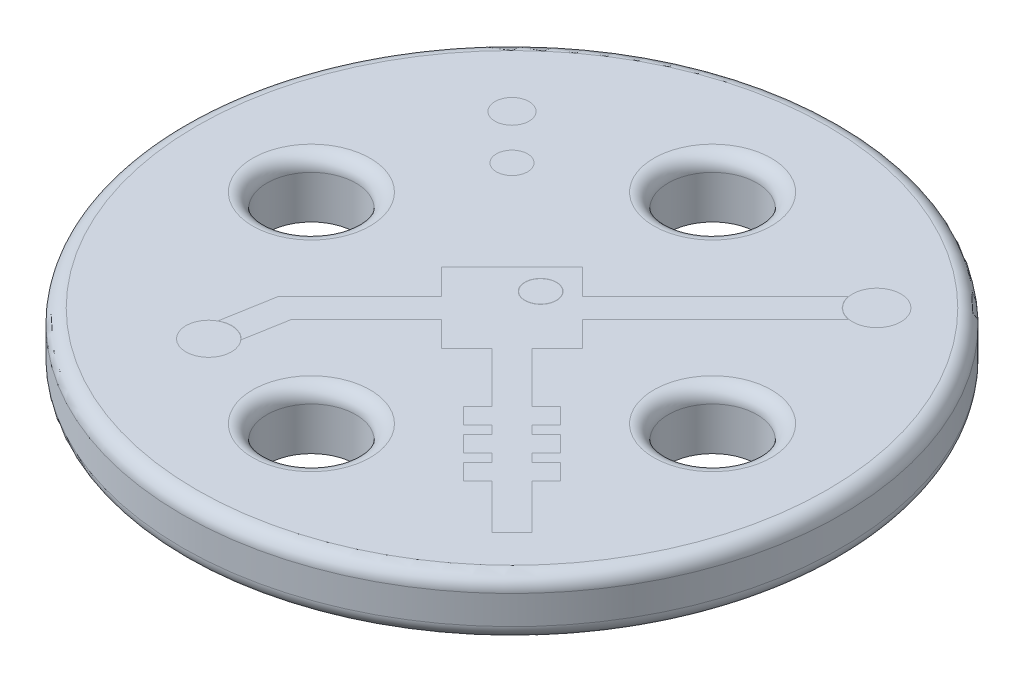
from build123d import *

# Parameters (mm, degrees)
SKETCH1_R                     = 11.5
SKETCH1_R_2                   = 1.55
BOSS_EXTRUDE1_DEPTH           = 2
FILLET1_R                     = 0.5
GL_F_SIDE_BLUE_CUT_START      = -0.5
GL_F_SIDE_BLUE_CUT_DEPTH      = 1.1
GL_F_SIDE_BLUE_INLAY_DEPTH    = 0.6
GL_F_SIDE_WHITE_CUT_START     = -0.5
GL_F_SIDE_WHITE_CUT_DEPTH     = 1.1
GL_F_SIDE_WHITE_INLAY_DEPTH   = 0.6
GL_F_SIDE_WHITE_INLAY_2_DEPTH = 0.6
GL_F_SIDE_WHITE_INLAY_3_DEPTH = 0.6
GL_F_SIDE_WHITE_INLAY_4_DEPTH = 0.6
GL_F_SIDE_WHITE_INLAY_5_DEPTH = 0.6
GL_E_SIDE_BLUE_CUT_START      = 1.4
GL_E_SIDE_BLUE_CUT_DEPTH      = 1.1
GL_E_SIDE_BLUE_INLAY_START    = 1.4
GL_E_SIDE_BLUE_INLAY_DEPTH    = 0.6
GL_E_SIDE_WHITE_CUT_START     = 1.4
GL_E_SIDE_WHITE_CUT_DEPTH     = 1.1
GL_E_SIDE_WHITE_INLAY_START   = 1.4
GL_E_SIDE_WHITE_INLAY_DEPTH   = 0.6
GL_E_SIDE_WHITE_INLAY_2_DEPTH = 0.6
GL_E_SIDE_WHITE_INLAY_3_DEPTH = 0.6
GL_E_SIDE_WHITE_INLAY_4_DEPTH = 0.6
GL_E_SIDE_WHITE_INLAY_5_DEPTH = 0.6


with BuildPart() as part:
    # Sketch1 → Boss-Extrude1 (new body)
    with BuildSketch(Plane(origin=(0, 0, 0), x_dir=(1, 0, 0), z_dir=(0, 1, 0))):
        Circle(SKETCH1_R)
        with Locations((0, 7)):
            Circle(SKETCH1_R_2, mode=Mode.SUBTRACT)
        with Locations((7, 0)):
            Circle(SKETCH1_R_2, mode=Mode.SUBTRACT)
        with Locations((0, -7)):
            Circle(SKETCH1_R_2, mode=Mode.SUBTRACT)
        with Locations((-7, 0)):
            Circle(SKETCH1_R_2, mode=Mode.SUBTRACT)
    extrude(amount=BOSS_EXTRUDE1_DEPTH)

    # Fillet1
    fillet1_edges = [part.edges().sort_by_distance(p)[0] for p in [
        (-8.55, 2, 0),
        (5.45, 2, 0),
        (-11.5, 2, 0),
        (-1.55, 2, -7),
        (-1.55, 2, 7),
        (-11.5, 0, 0),
    ]]
    fillet(fillet1_edges, radius=FILLET1_R)

    # GL_F_side_blue → GL_F_side_blue_cut (cut)
    with BuildSketch(Plane(origin=(0, 0, 0), x_dir=(1, 0, 0), z_dir=(0, 1, 0)).offset(GL_F_SIDE_BLUE_CUT_START)):
        Polygon((4.101219331, -5.791204538), (3.542604974, -5.232590181), (4.037579721, -4.737615434), (3.74766594, -4.447701654), (3.252691193, -4.9426764), (2.694076836, -4.384062043), (3.189051583, -3.889087297), (1.209152596, -1.909188309), (1.323340905, -1.795), (-1.795, -1.795), (-1.795, 1.323340905), (-1.909188309, 1.209152596), (-4.851953883, 4.151918169), (-4.716054022, 4.179390353), (-4.570146913, 4.239827057), (-4.380487824, 4.380487824), (-4.239827057, 4.570146913), (-4.179390353, 4.716054022), (-4.151918169, 4.851953883), (-1.209152596, 1.909188309), (-1.323340905, 1.795), (1.323340905, 1.795), (1.209152596, 1.909188309), (5.663722497, 6.363758211), (5.687194875, 6.257134584), (5.751365912, 6.102211995), (5.900767403, 5.900767403), (6.102211995, 5.751365912), (6.257134584, 5.687194875), (6.363758211, 5.663722497), (1.909188309, 1.209152596), (1.795, 1.323340905), (1.795, -1.323340905), (1.909188309, -1.209152596), (3.889087297, -3.189051583), (4.384062043, -2.694076836), (4.9426764, -3.252691193), (4.447701654, -3.74766594), (4.737615434, -4.037579721), (5.232590181, -3.542604974), (5.791204538, -4.101219331), (5.296229791, -4.596194078), (6.993286066, -6.293250353), (6.293250353, -6.993286066), (4.596194078, -5.296229791), align=None)
        Polygon((-0.296176538, 0.794126253), (-0.296176538, 0.902930022), (-0.3174031, 1.009643156), (-0.3590405, 1.110164731), (-0.419488634, 1.200631758), (-0.496424517, 1.27756764), (-0.586891544, 1.338015775), (-0.687413119, 1.379653175), (-0.794126253, 1.400879737), (-0.902930022, 1.400879737), (-1.009643156, 1.379653175), (-1.110164731, 1.338015775), (-1.200631758, 1.27756764), (-1.27756764, 1.200631758), (-1.338015775, 1.110164731), (-1.379653175, 1.009643156), (-1.400879737, 0.902930022), (-1.400879737, 0.794126253), (-1.379653175, 0.687413119), (-1.338015775, 0.586891544), (-1.27756764, 0.496424517), (-1.200631758, 0.419488634), (-1.110164731, 0.3590405), (-1.009643156, 0.3174031), (-0.902930022, 0.296176538), (-0.794126253, 0.296176538), (-0.687413119, 0.3174031), (-0.586891544, 0.3590405), (-0.496424517, 0.419488634), (-0.419488634, 0.496424517), (-0.3590405, 0.586891544), (-0.3174031, 0.687413119), align=None, mode=Mode.SUBTRACT)
    extrude(amount=GL_F_SIDE_BLUE_CUT_DEPTH, mode=Mode.SUBTRACT)

    # GL_F_side_white → GL_F_side_white_cut (cut)
    with BuildSketch(Plane(origin=(0, 0, 0), x_dir=(1, 0, 0), z_dir=(0, 1, 0)).offset(GL_F_SIDE_WHITE_CUT_START)):
        Polygon((-5.627987495, -6.383890654), (-5.695762229, -6.466474407), (-5.778345982, -6.534249141), (-5.872565106, -6.584610312), (-5.974798812, -6.615622568), (-6.081118318, -6.626094125), (-6.187437824, -6.615622568), (-6.289671531, -6.584610312), (-6.383890654, -6.534249141), (-6.466474407, -6.466474407), (-6.534249141, -6.383890654), (-6.584610312, -6.289671531), (-6.615622568, -6.187437824), (-6.626094125, -6.081118318), (-6.615622568, -5.974798812), (-6.584610312, -5.872565106), (-6.534249141, -5.778345982), (-6.466474407, -5.695762229), (-6.383890654, -5.627987495), (-6.289671531, -5.577626324), (-6.187437824, -5.546614068), (-6.081118318, -5.536142511), (-5.974798812, -5.546614068), (-5.872565106, -5.577626324), (-5.778345982, -5.627987495), (-5.695762229, -5.695762229), (-5.627987495, -5.778345982), (-5.577626324, -5.872565106), (-5.546614068, -5.974798812), (-5.536142511, -6.081118318), (-5.546614068, -6.187437824), (-5.577626324, -6.289671531), align=None)
        Polygon((-3.789509864, -4.545413023), (-3.857284598, -4.627996776), (-3.939868351, -4.69577151), (-4.034087475, -4.746132681), (-4.136321181, -4.777144937), (-4.242640687, -4.787616494), (-4.348960193, -4.777144937), (-4.4511939, -4.746132681), (-4.545413023, -4.69577151), (-4.627996776, -4.627996776), (-4.69577151, -4.545413023), (-4.746132681, -4.4511939), (-4.777144937, -4.348960193), (-4.787616494, -4.242640687), (-4.777144937, -4.136321181), (-4.746132681, -4.034087475), (-4.69577151, -3.939868351), (-4.627996776, -3.857284598), (-4.545413023, -3.789509864), (-4.4511939, -3.739148693), (-4.348960193, -3.708136437), (-4.242640687, -3.69766488), (-4.136321181, -3.708136437), (-4.034087475, -3.739148693), (-3.939868351, -3.789509864), (-3.857284598, -3.857284598), (-3.789509864, -3.939868351), (-3.739148693, -4.034087475), (-3.708136437, -4.136321181), (-3.69766488, -4.242640687), (-3.708136437, -4.348960193), (-3.739148693, -4.4511939), align=None)
        Polygon((-0.395397314, 0.545755801), (-0.463172049, 0.463172049), (-0.545755801, 0.395397314), (-0.639974925, 0.345036143), (-0.742208632, 0.314023888), (-0.848528137, 0.30355233), (-0.954847643, 0.314023888), (-1.05708135, 0.345036143), (-1.151300474, 0.395397314), (-1.233884226, 0.463172049), (-1.30165896, 0.545755801), (-1.352020131, 0.639974925), (-1.383032387, 0.742208632), (-1.393503945, 0.848528137), (-1.383032387, 0.954847643), (-1.352020131, 1.05708135), (-1.30165896, 1.151300474), (-1.233884226, 1.233884226), (-1.151300474, 1.30165896), (-1.05708135, 1.352020131), (-0.954847643, 1.383032387), (-0.848528137, 1.393503945), (-0.742208632, 1.383032387), (-0.639974925, 1.352020131), (-0.545755801, 1.30165896), (-0.463172049, 1.233884226), (-0.395397314, 1.151300474), (-0.345036143, 1.05708135), (-0.314023888, 0.954847643), (-0.30355233, 0.848528137), (-0.314023888, 0.742208632), (-0.345036143, 0.639974925), align=None)
        Polygon((-4.387614684, 4.387614684), (-4.508082574, 4.288749242), (-4.645523398, 4.215285591), (-4.794655382, 4.170046898), (-4.949747468, 4.154771661), (-5.104839555, 4.170046898), (-5.253971539, 4.215285591), (-5.391412363, 4.288749242), (-5.511880252, 4.387614684), (-5.610745694, 4.508082574), (-5.684209345, 4.645523398), (-5.729448038, 4.794655382), (-5.744723275, 4.949747468), (-5.729448038, 5.104839555), (-5.684209345, 5.253971539), (-5.610745694, 5.391412363), (-5.511880252, 5.511880252), (-5.391412363, 5.610745694), (-5.253971539, 5.684209345), (-5.104839555, 5.729448038), (-4.949747468, 5.744723275), (-4.794655382, 5.729448038), (-4.645523398, 5.684209345), (-4.508082574, 5.610745694), (-4.387614684, 5.511880252), (-4.288749242, 5.391412363), (-4.215285591, 5.253971539), (-4.170046898, 5.104839555), (-4.154771661, 4.949747468), (-4.170046898, 4.794655382), (-4.215285591, 4.645523398), (-4.288749242, 4.508082574), align=None)
        Polygon((7.10287051, 5.907894264), (6.974825793, 5.80281068), (6.828740629, 5.724726533), (6.670228989, 5.676642553), (6.505382387, 5.66040658), (6.340535785, 5.676642553), (6.182024145, 5.724726533), (6.035938981, 5.80281068), (5.907894264, 5.907894264), (5.80281068, 6.035938981), (5.724726533, 6.182024145), (5.676642553, 6.340535785), (5.66040658, 6.505382387), (5.676642553, 6.670228989), (5.724726533, 6.828740629), (5.80281068, 6.974825793), (5.907894264, 7.10287051), (6.035938981, 7.207954094), (6.182024145, 7.286038241), (6.340535785, 7.334122221), (6.505382387, 7.350358194), (6.670228989, 7.334122221), (6.828740629, 7.286038241), (6.974825793, 7.207954094), (7.10287051, 7.10287051), (7.207954094, 6.974825793), (7.286038241, 6.828740629), (7.334122221, 6.670228989), (7.350358194, 6.505382387), (7.334122221, 6.340535785), (7.286038241, 6.182024145), (7.207954094, 6.035938981), align=None)
    extrude(amount=GL_F_SIDE_WHITE_CUT_DEPTH, mode=Mode.SUBTRACT)

    # GL_E_side_blue → GL_E_side_blue_cut (cut)
    with BuildSketch(Plane(origin=(0, 0, 0), x_dir=(1, 0, 0), z_dir=(0, 1, 0)).offset(GL_E_SIDE_BLUE_CUT_START)):
        Polygon((4.384062043, -6.07404725), (3.825447686, -5.515432893), (4.320422433, -5.020458146), (4.030508653, -4.730544366), (3.535533906, -5.225519113), (2.976919549, -4.666904756), (3.471894296, -4.171930009), (3.181980515, -3.882016229), (2.687005769, -4.376990976), (2.128391411, -3.818376618), (2.623366158, -3.323401872), (0.883883476, -1.58391919), (0, -2.467802666), (-0.883883476, -1.58391919), (-3.499409102, -4.199444815), (-3.761831835, -5.688207176), (-3.84849988, -5.603249452), (-3.979798436, -5.515518562), (-4.202004851, -5.436011835), (-4.359180916, -5.420531344), (-4.516373466, -5.436013459), (-4.736831203, -5.516520655), (-4.420186847, -3.720151134), (-1.58391919, -0.883883476), (-2.467802666, 0), (0, 2.467802666), (0.883883476, 1.58391919), (5.522301141, 6.222336854), (5.545773518, 6.115713228), (5.609944556, 5.960790639), (5.759346047, 5.759346047), (5.960790639, 5.609944556), (6.115713228, 5.545773518), (6.222336854, 5.522301141), (1.58391919, 0.883883476), (2.467802666, 0), (1.58391919, -0.883883476), (3.323401872, -2.623366158), (3.818376618, -2.128391411), (4.376990976, -2.687005769), (3.882016229, -3.181980515), (4.171930009, -3.471894296), (4.666904756, -2.976919549), (5.225519113, -3.535533906), (4.730544366, -4.030508653), (5.020458146, -4.320422433), (5.515432893, -3.825447686), (6.07404725, -4.384062043), (5.579072504, -4.87903679), (7.134707422, -6.434671709), (6.434671709, -7.134707422), (4.87903679, -5.579072504), align=None)
        Polygon((0.5523516, 0.945598116), (0.5523516, 1.054401884), (0.531125037, 1.161115019), (0.489487638, 1.261636593), (0.429039503, 1.35210362), (0.35210362, 1.429039503), (0.261636593, 1.489487638), (0.161115019, 1.531125037), (0.054401884, 1.5523516), (-0.054401884, 1.5523516), (-0.161115019, 1.531125037), (-0.261636593, 1.489487638), (-0.35210362, 1.429039503), (-0.429039503, 1.35210362), (-0.489487638, 1.261636593), (-0.531125037, 1.161115019), (-0.5523516, 1.054401884), (-0.5523516, 0.945598116), (-0.531125037, 0.838884981), (-0.489487638, 0.738363407), (-0.429039503, 0.64789638), (-0.35210362, 0.570960497), (-0.261636593, 0.510512362), (-0.161115019, 0.468874963), (-0.054401884, 0.4476484), (0.054401884, 0.4476484), (0.161115019, 0.468874963), (0.261636593, 0.510512362), (0.35210362, 0.570960497), (0.429039503, 0.64789638), (0.489487638, 0.738363407), (0.531125037, 0.838884981), align=None, mode=Mode.SUBTRACT)
    extrude(amount=GL_E_SIDE_BLUE_CUT_DEPTH, mode=Mode.SUBTRACT)

    # GL_E_side_white → GL_E_side_white_cut (cut)
    with BuildSketch(Plane(origin=(0, 0, 0), x_dir=(1, 0, 0), z_dir=(0, 1, 0)).offset(GL_E_SIDE_WHITE_CUT_START)):
        Polygon((-3.69818269, -6.667220431), (-3.797048132, -6.787688321), (-3.917516022, -6.886553763), (-4.054956846, -6.960017414), (-4.20408883, -7.005256107), (-4.359180916, -7.020531344), (-4.514273002, -7.005256107), (-4.663404987, -6.960017414), (-4.800845811, -6.886553763), (-4.9213137, -6.787688321), (-5.020179142, -6.667220431), (-5.093642793, -6.529779607), (-5.138881486, -6.380647623), (-5.154156723, -6.225555537), (-5.138881486, -6.07046345), (-5.093642793, -5.921331466), (-5.020179142, -5.783890642), (-4.9213137, -5.663422752), (-4.800845811, -5.56455731), (-4.663404987, -5.49109366), (-4.514273002, -5.445854967), (-4.359180916, -5.430579729), (-4.20408883, -5.445854967), (-4.054956846, -5.49109366), (-3.917516022, -5.56455731), (-3.797048132, -5.663422752), (-3.69818269, -5.783890642), (-3.624719039, -5.921331466), (-3.579480346, -6.07046345), (-3.564205109, -6.225555537), (-3.579480346, -6.380647623), (-3.624719039, -6.529779607), align=None)
        Polygon((0.453130823, 0.697227664), (0.385356089, 0.614643911), (0.302772336, 0.546869177), (0.208553212, 0.496508006), (0.106319506, 0.46549575), (0, 0.455024193), (-0.106319506, 0.46549575), (-0.208553212, 0.496508006), (-0.302772336, 0.546869177), (-0.385356089, 0.614643911), (-0.453130823, 0.697227664), (-0.503491994, 0.791446788), (-0.53450425, 0.893680494), (-0.544975807, 1), (-0.53450425, 1.106319506), (-0.503491994, 1.208553212), (-0.453130823, 1.302772336), (-0.385356089, 1.385356089), (-0.302772336, 1.453130823), (-0.208553212, 1.503491994), (-0.106319506, 1.53450425), (0, 1.544975807), (0.106319506, 1.53450425), (0.208553212, 1.503491994), (0.302772336, 1.453130823), (0.385356089, 1.385356089), (0.453130823, 1.302772336), (0.503491994, 1.208553212), (0.53450425, 1.106319506), (0.544975807, 1), (0.53450425, 0.893680494), (0.503491994, 0.791446788), align=None)
        Polygon((-3.93093122, 4.081289707), (-3.998705955, 3.998705955), (-4.081289707, 3.93093122), (-4.175508831, 3.880570049), (-4.277742538, 3.849557794), (-4.384062043, 3.839086236), (-4.490381549, 3.849557794), (-4.592615256, 3.880570049), (-4.68683438, 3.93093122), (-4.769418132, 3.998705955), (-4.837192866, 4.081289707), (-4.887554037, 4.175508831), (-4.918566293, 4.277742538), (-4.92903785, 4.384062043), (-4.918566293, 4.490381549), (-4.887554037, 4.592615256), (-4.837192866, 4.68683438), (-4.769418132, 4.769418132), (-4.68683438, 4.837192866), (-4.592615256, 4.887554037), (-4.490381549, 4.918566293), (-4.384062043, 4.92903785), (-4.277742538, 4.918566293), (-4.175508831, 4.887554037), (-4.081289707, 4.837192866), (-3.998705955, 4.769418132), (-3.93093122, 4.68683438), (-3.880570049, 4.592615256), (-3.849557794, 4.490381549), (-3.839086236, 4.384062043), (-3.849557794, 4.277742538), (-3.880570049, 4.175508831), align=None)
        Polygon((-5.518985534, 5.518985534), (-5.609146114, 5.444992658), (-5.712009578, 5.390010991), (-5.82362294, 5.356153448), (-5.939696962, 5.344721155), (-6.055770984, 5.356153448), (-6.167384346, 5.390010991), (-6.27024781, 5.444992658), (-6.36040839, 5.518985534), (-6.434401266, 5.609146114), (-6.489382933, 5.712009578), (-6.523240476, 5.82362294), (-6.534672769, 5.939696962), (-6.523240476, 6.055770984), (-6.489382933, 6.167384346), (-6.434401266, 6.27024781), (-6.36040839, 6.36040839), (-6.27024781, 6.434401266), (-6.167384346, 6.489382933), (-6.055770984, 6.523240476), (-5.939696962, 6.534672769), (-5.82362294, 6.523240476), (-5.712009578, 6.489382933), (-5.609146114, 6.434401266), (-5.518985534, 6.36040839), (-5.444992658, 6.27024781), (-5.390010991, 6.167384346), (-5.356153448, 6.055770984), (-5.344721155, 5.939696962), (-5.356153448, 5.82362294), (-5.390010991, 5.712009578), (-5.444992658, 5.609146114), align=None)
        Polygon((6.961449154, 5.766472908), (6.833404437, 5.661389324), (6.687319273, 5.583305177), (6.528807633, 5.535221197), (6.363961031, 5.518985224), (6.199114428, 5.535221197), (6.040602789, 5.583305177), (5.894517625, 5.661389324), (5.766472908, 5.766472908), (5.661389324, 5.894517625), (5.583305177, 6.040602789), (5.535221197, 6.199114428), (5.518985224, 6.363961031), (5.535221197, 6.528807633), (5.583305177, 6.687319273), (5.661389324, 6.833404437), (5.766472908, 6.961449154), (5.894517625, 7.066532737), (6.040602789, 7.144616884), (6.199114428, 7.192700865), (6.363961031, 7.208936838), (6.528807633, 7.192700865), (6.687319273, 7.144616884), (6.833404437, 7.066532737), (6.961449154, 6.961449154), (7.066532737, 6.833404437), (7.144616884, 6.687319273), (7.192700865, 6.528807633), (7.208936838, 6.363961031), (7.192700865, 6.199114428), (7.144616884, 6.040602789), (7.066532737, 5.894517625), align=None)
    extrude(amount=GL_E_SIDE_WHITE_CUT_DEPTH, mode=Mode.SUBTRACT)


with BuildPart() as body_2:
    # GL_F_side_blue<2> → GL_F_side_blue_inlay (new body)
    with BuildSketch(Plane(origin=(0, 0, 0), x_dir=(1, 0, 0), z_dir=(0, 1, 0))):
        Polygon((4.101219331, -5.791204538), (3.542604974, -5.232590181), (4.037579721, -4.737615434), (3.74766594, -4.447701654), (3.252691193, -4.9426764), (2.694076836, -4.384062043), (3.189051583, -3.889087297), (1.209152596, -1.909188309), (1.323340905, -1.795), (-1.795, -1.795), (-1.795, 1.323340905), (-1.909188309, 1.209152596), (-4.851953883, 4.151918169), (-4.716054022, 4.179390353), (-4.570146913, 4.239827057), (-4.380487824, 4.380487824), (-4.239827057, 4.570146913), (-4.179390353, 4.716054022), (-4.151918169, 4.851953883), (-1.209152596, 1.909188309), (-1.323340905, 1.795), (1.323340905, 1.795), (1.209152596, 1.909188309), (5.663722497, 6.363758211), (5.687194875, 6.257134584), (5.751365912, 6.102211995), (5.900767403, 5.900767403), (6.102211995, 5.751365912), (6.257134584, 5.687194875), (6.363758211, 5.663722497), (1.909188309, 1.209152596), (1.795, 1.323340905), (1.795, -1.323340905), (1.909188309, -1.209152596), (3.889087297, -3.189051583), (4.384062043, -2.694076836), (4.9426764, -3.252691193), (4.447701654, -3.74766594), (4.737615434, -4.037579721), (5.232590181, -3.542604974), (5.791204538, -4.101219331), (5.296229791, -4.596194078), (6.993286066, -6.293250353), (6.293250353, -6.993286066), (4.596194078, -5.296229791), align=None)
        Polygon((-0.296176538, 0.794126253), (-0.296176538, 0.902930022), (-0.3174031, 1.009643156), (-0.3590405, 1.110164731), (-0.419488634, 1.200631758), (-0.496424517, 1.27756764), (-0.586891544, 1.338015775), (-0.687413119, 1.379653175), (-0.794126253, 1.400879737), (-0.902930022, 1.400879737), (-1.009643156, 1.379653175), (-1.110164731, 1.338015775), (-1.200631758, 1.27756764), (-1.27756764, 1.200631758), (-1.338015775, 1.110164731), (-1.379653175, 1.009643156), (-1.400879737, 0.902930022), (-1.400879737, 0.794126253), (-1.379653175, 0.687413119), (-1.338015775, 0.586891544), (-1.27756764, 0.496424517), (-1.200631758, 0.419488634), (-1.110164731, 0.3590405), (-1.009643156, 0.3174031), (-0.902930022, 0.296176538), (-0.794126253, 0.296176538), (-0.687413119, 0.3174031), (-0.586891544, 0.3590405), (-0.496424517, 0.419488634), (-0.419488634, 0.496424517), (-0.3590405, 0.586891544), (-0.3174031, 0.687413119), align=None, mode=Mode.SUBTRACT)
    extrude(amount=GL_F_SIDE_BLUE_INLAY_DEPTH)


with BuildPart() as body_3:
    # GL_F_side_white<2> → GL_F_side_white_inlay (new body)
    with BuildSketch(Plane(origin=(0, 0, 0), x_dir=(1, 0, 0), z_dir=(0, 1, 0))):
        Polygon((-5.627987495, -6.383890654), (-5.695762229, -6.466474407), (-5.778345982, -6.534249141), (-5.872565106, -6.584610312), (-5.974798812, -6.615622568), (-6.081118318, -6.626094125), (-6.187437824, -6.615622568), (-6.289671531, -6.584610312), (-6.383890654, -6.534249141), (-6.466474407, -6.466474407), (-6.534249141, -6.383890654), (-6.584610312, -6.289671531), (-6.615622568, -6.187437824), (-6.626094125, -6.081118318), (-6.615622568, -5.974798812), (-6.584610312, -5.872565106), (-6.534249141, -5.778345982), (-6.466474407, -5.695762229), (-6.383890654, -5.627987495), (-6.289671531, -5.577626324), (-6.187437824, -5.546614068), (-6.081118318, -5.536142511), (-5.974798812, -5.546614068), (-5.872565106, -5.577626324), (-5.778345982, -5.627987495), (-5.695762229, -5.695762229), (-5.627987495, -5.778345982), (-5.577626324, -5.872565106), (-5.546614068, -5.974798812), (-5.536142511, -6.081118318), (-5.546614068, -6.187437824), (-5.577626324, -6.289671531), align=None)
    extrude(amount=GL_F_SIDE_WHITE_INLAY_DEPTH)


with BuildPart() as body_4:
    # GL_F_side_white<2> → GL_F_side_white_inlay 2 (new body)
    with BuildSketch(Plane(origin=(0, 0, 0), x_dir=(1, 0, 0), z_dir=(0, 1, 0))):
        Polygon((-3.789509864, -4.545413023), (-3.857284598, -4.627996776), (-3.939868351, -4.69577151), (-4.034087475, -4.746132681), (-4.136321181, -4.777144937), (-4.242640687, -4.787616494), (-4.348960193, -4.777144937), (-4.4511939, -4.746132681), (-4.545413023, -4.69577151), (-4.627996776, -4.627996776), (-4.69577151, -4.545413023), (-4.746132681, -4.4511939), (-4.777144937, -4.348960193), (-4.787616494, -4.242640687), (-4.777144937, -4.136321181), (-4.746132681, -4.034087475), (-4.69577151, -3.939868351), (-4.627996776, -3.857284598), (-4.545413023, -3.789509864), (-4.4511939, -3.739148693), (-4.348960193, -3.708136437), (-4.242640687, -3.69766488), (-4.136321181, -3.708136437), (-4.034087475, -3.739148693), (-3.939868351, -3.789509864), (-3.857284598, -3.857284598), (-3.789509864, -3.939868351), (-3.739148693, -4.034087475), (-3.708136437, -4.136321181), (-3.69766488, -4.242640687), (-3.708136437, -4.348960193), (-3.739148693, -4.4511939), align=None)
    extrude(amount=GL_F_SIDE_WHITE_INLAY_2_DEPTH)


with BuildPart() as body_5:
    # GL_F_side_white<2> → GL_F_side_white_inlay 3 (new body)
    with BuildSketch(Plane(origin=(0, 0, 0), x_dir=(1, 0, 0), z_dir=(0, 1, 0))):
        Polygon((-0.395397314, 0.545755801), (-0.463172049, 0.463172049), (-0.545755801, 0.395397314), (-0.639974925, 0.345036143), (-0.742208632, 0.314023888), (-0.848528137, 0.30355233), (-0.954847643, 0.314023888), (-1.05708135, 0.345036143), (-1.151300474, 0.395397314), (-1.233884226, 0.463172049), (-1.30165896, 0.545755801), (-1.352020131, 0.639974925), (-1.383032387, 0.742208632), (-1.393503945, 0.848528137), (-1.383032387, 0.954847643), (-1.352020131, 1.05708135), (-1.30165896, 1.151300474), (-1.233884226, 1.233884226), (-1.151300474, 1.30165896), (-1.05708135, 1.352020131), (-0.954847643, 1.383032387), (-0.848528137, 1.393503945), (-0.742208632, 1.383032387), (-0.639974925, 1.352020131), (-0.545755801, 1.30165896), (-0.463172049, 1.233884226), (-0.395397314, 1.151300474), (-0.345036143, 1.05708135), (-0.314023888, 0.954847643), (-0.30355233, 0.848528137), (-0.314023888, 0.742208632), (-0.345036143, 0.639974925), align=None)
    extrude(amount=GL_F_SIDE_WHITE_INLAY_3_DEPTH)


with BuildPart() as body_6:
    # GL_F_side_white<2> → GL_F_side_white_inlay 4 (new body)
    with BuildSketch(Plane(origin=(0, 0, 0), x_dir=(1, 0, 0), z_dir=(0, 1, 0))):
        Polygon((-4.387614684, 4.387614684), (-4.508082574, 4.288749242), (-4.645523398, 4.215285591), (-4.794655382, 4.170046898), (-4.949747468, 4.154771661), (-5.104839555, 4.170046898), (-5.253971539, 4.215285591), (-5.391412363, 4.288749242), (-5.511880252, 4.387614684), (-5.610745694, 4.508082574), (-5.684209345, 4.645523398), (-5.729448038, 4.794655382), (-5.744723275, 4.949747468), (-5.729448038, 5.104839555), (-5.684209345, 5.253971539), (-5.610745694, 5.391412363), (-5.511880252, 5.511880252), (-5.391412363, 5.610745694), (-5.253971539, 5.684209345), (-5.104839555, 5.729448038), (-4.949747468, 5.744723275), (-4.794655382, 5.729448038), (-4.645523398, 5.684209345), (-4.508082574, 5.610745694), (-4.387614684, 5.511880252), (-4.288749242, 5.391412363), (-4.215285591, 5.253971539), (-4.170046898, 5.104839555), (-4.154771661, 4.949747468), (-4.170046898, 4.794655382), (-4.215285591, 4.645523398), (-4.288749242, 4.508082574), align=None)
    extrude(amount=GL_F_SIDE_WHITE_INLAY_4_DEPTH)


with BuildPart() as body_7:
    # GL_F_side_white<2> → GL_F_side_white_inlay 5 (new body)
    with BuildSketch(Plane(origin=(0, 0, 0), x_dir=(1, 0, 0), z_dir=(0, 1, 0))):
        Polygon((7.10287051, 5.907894264), (6.974825793, 5.80281068), (6.828740629, 5.724726533), (6.670228989, 5.676642553), (6.505382387, 5.66040658), (6.340535785, 5.676642553), (6.182024145, 5.724726533), (6.035938981, 5.80281068), (5.907894264, 5.907894264), (5.80281068, 6.035938981), (5.724726533, 6.182024145), (5.676642553, 6.340535785), (5.66040658, 6.505382387), (5.676642553, 6.670228989), (5.724726533, 6.828740629), (5.80281068, 6.974825793), (5.907894264, 7.10287051), (6.035938981, 7.207954094), (6.182024145, 7.286038241), (6.340535785, 7.334122221), (6.505382387, 7.350358194), (6.670228989, 7.334122221), (6.828740629, 7.286038241), (6.974825793, 7.207954094), (7.10287051, 7.10287051), (7.207954094, 6.974825793), (7.286038241, 6.828740629), (7.334122221, 6.670228989), (7.350358194, 6.505382387), (7.334122221, 6.340535785), (7.286038241, 6.182024145), (7.207954094, 6.035938981), align=None)
    extrude(amount=GL_F_SIDE_WHITE_INLAY_5_DEPTH)


with BuildPart() as body_8:
    # GL_E_side_blue<2> → GL_E_side_blue_inlay (new body)
    with BuildSketch(Plane(origin=(0, 0, 0), x_dir=(1, 0, 0), z_dir=(0, 1, 0)).offset(GL_E_SIDE_BLUE_INLAY_START)):
        Polygon((4.384062043, -6.07404725), (3.825447686, -5.515432893), (4.320422433, -5.020458146), (4.030508653, -4.730544366), (3.535533906, -5.225519113), (2.976919549, -4.666904756), (3.471894296, -4.171930009), (3.181980515, -3.882016229), (2.687005769, -4.376990976), (2.128391411, -3.818376618), (2.623366158, -3.323401872), (0.883883476, -1.58391919), (0, -2.467802666), (-0.883883476, -1.58391919), (-3.499409102, -4.199444815), (-3.761831835, -5.688207176), (-3.84849988, -5.603249452), (-3.979798436, -5.515518562), (-4.202004851, -5.436011835), (-4.359180916, -5.420531344), (-4.516373466, -5.436013459), (-4.736831203, -5.516520655), (-4.420186847, -3.720151134), (-1.58391919, -0.883883476), (-2.467802666, 0), (0, 2.467802666), (0.883883476, 1.58391919), (5.522301141, 6.222336854), (5.545773518, 6.115713228), (5.609944556, 5.960790639), (5.759346047, 5.759346047), (5.960790639, 5.609944556), (6.115713228, 5.545773518), (6.222336854, 5.522301141), (1.58391919, 0.883883476), (2.467802666, 0), (1.58391919, -0.883883476), (3.323401872, -2.623366158), (3.818376618, -2.128391411), (4.376990976, -2.687005769), (3.882016229, -3.181980515), (4.171930009, -3.471894296), (4.666904756, -2.976919549), (5.225519113, -3.535533906), (4.730544366, -4.030508653), (5.020458146, -4.320422433), (5.515432893, -3.825447686), (6.07404725, -4.384062043), (5.579072504, -4.87903679), (7.134707422, -6.434671709), (6.434671709, -7.134707422), (4.87903679, -5.579072504), align=None)
        Polygon((0.5523516, 0.945598116), (0.5523516, 1.054401884), (0.531125037, 1.161115019), (0.489487638, 1.261636593), (0.429039503, 1.35210362), (0.35210362, 1.429039503), (0.261636593, 1.489487638), (0.161115019, 1.531125037), (0.054401884, 1.5523516), (-0.054401884, 1.5523516), (-0.161115019, 1.531125037), (-0.261636593, 1.489487638), (-0.35210362, 1.429039503), (-0.429039503, 1.35210362), (-0.489487638, 1.261636593), (-0.531125037, 1.161115019), (-0.5523516, 1.054401884), (-0.5523516, 0.945598116), (-0.531125037, 0.838884981), (-0.489487638, 0.738363407), (-0.429039503, 0.64789638), (-0.35210362, 0.570960497), (-0.261636593, 0.510512362), (-0.161115019, 0.468874963), (-0.054401884, 0.4476484), (0.054401884, 0.4476484), (0.161115019, 0.468874963), (0.261636593, 0.510512362), (0.35210362, 0.570960497), (0.429039503, 0.64789638), (0.489487638, 0.738363407), (0.531125037, 0.838884981), align=None, mode=Mode.SUBTRACT)
    extrude(amount=GL_E_SIDE_BLUE_INLAY_DEPTH)


with BuildPart() as body_9:
    # GL_E_side_white<2> → GL_E_side_white_inlay (new body)
    with BuildSketch(Plane(origin=(0, 0, 0), x_dir=(1, 0, 0), z_dir=(0, 1, 0)).offset(GL_E_SIDE_WHITE_INLAY_START)):
        Polygon((-3.69818269, -6.667220431), (-3.797048132, -6.787688321), (-3.917516022, -6.886553763), (-4.054956846, -6.960017414), (-4.20408883, -7.005256107), (-4.359180916, -7.020531344), (-4.514273002, -7.005256107), (-4.663404987, -6.960017414), (-4.800845811, -6.886553763), (-4.9213137, -6.787688321), (-5.020179142, -6.667220431), (-5.093642793, -6.529779607), (-5.138881486, -6.380647623), (-5.154156723, -6.225555537), (-5.138881486, -6.07046345), (-5.093642793, -5.921331466), (-5.020179142, -5.783890642), (-4.9213137, -5.663422752), (-4.800845811, -5.56455731), (-4.663404987, -5.49109366), (-4.514273002, -5.445854967), (-4.359180916, -5.430579729), (-4.20408883, -5.445854967), (-4.054956846, -5.49109366), (-3.917516022, -5.56455731), (-3.797048132, -5.663422752), (-3.69818269, -5.783890642), (-3.624719039, -5.921331466), (-3.579480346, -6.07046345), (-3.564205109, -6.225555537), (-3.579480346, -6.380647623), (-3.624719039, -6.529779607), align=None)
    extrude(amount=GL_E_SIDE_WHITE_INLAY_DEPTH)


with BuildPart() as body_10:
    # GL_E_side_white<2> → GL_E_side_white_inlay 2 (new body)
    with BuildSketch(Plane(origin=(0, 0, 0), x_dir=(1, 0, 0), z_dir=(0, 1, 0)).offset(GL_E_SIDE_WHITE_INLAY_START)):
        Polygon((0.453130823, 0.697227664), (0.385356089, 0.614643911), (0.302772336, 0.546869177), (0.208553212, 0.496508006), (0.106319506, 0.46549575), (0, 0.455024193), (-0.106319506, 0.46549575), (-0.208553212, 0.496508006), (-0.302772336, 0.546869177), (-0.385356089, 0.614643911), (-0.453130823, 0.697227664), (-0.503491994, 0.791446788), (-0.53450425, 0.893680494), (-0.544975807, 1), (-0.53450425, 1.106319506), (-0.503491994, 1.208553212), (-0.453130823, 1.302772336), (-0.385356089, 1.385356089), (-0.302772336, 1.453130823), (-0.208553212, 1.503491994), (-0.106319506, 1.53450425), (0, 1.544975807), (0.106319506, 1.53450425), (0.208553212, 1.503491994), (0.302772336, 1.453130823), (0.385356089, 1.385356089), (0.453130823, 1.302772336), (0.503491994, 1.208553212), (0.53450425, 1.106319506), (0.544975807, 1), (0.53450425, 0.893680494), (0.503491994, 0.791446788), align=None)
    extrude(amount=GL_E_SIDE_WHITE_INLAY_2_DEPTH)


with BuildPart() as body_11:
    # GL_E_side_white<2> → GL_E_side_white_inlay 3 (new body)
    with BuildSketch(Plane(origin=(0, 0, 0), x_dir=(1, 0, 0), z_dir=(0, 1, 0)).offset(GL_E_SIDE_WHITE_INLAY_START)):
        Polygon((-3.93093122, 4.081289707), (-3.998705955, 3.998705955), (-4.081289707, 3.93093122), (-4.175508831, 3.880570049), (-4.277742538, 3.849557794), (-4.384062043, 3.839086236), (-4.490381549, 3.849557794), (-4.592615256, 3.880570049), (-4.68683438, 3.93093122), (-4.769418132, 3.998705955), (-4.837192866, 4.081289707), (-4.887554037, 4.175508831), (-4.918566293, 4.277742538), (-4.92903785, 4.384062043), (-4.918566293, 4.490381549), (-4.887554037, 4.592615256), (-4.837192866, 4.68683438), (-4.769418132, 4.769418132), (-4.68683438, 4.837192866), (-4.592615256, 4.887554037), (-4.490381549, 4.918566293), (-4.384062043, 4.92903785), (-4.277742538, 4.918566293), (-4.175508831, 4.887554037), (-4.081289707, 4.837192866), (-3.998705955, 4.769418132), (-3.93093122, 4.68683438), (-3.880570049, 4.592615256), (-3.849557794, 4.490381549), (-3.839086236, 4.384062043), (-3.849557794, 4.277742538), (-3.880570049, 4.175508831), align=None)
    extrude(amount=GL_E_SIDE_WHITE_INLAY_3_DEPTH)


with BuildPart() as body_12:
    # GL_E_side_white<2> → GL_E_side_white_inlay 4 (new body)
    with BuildSketch(Plane(origin=(0, 0, 0), x_dir=(1, 0, 0), z_dir=(0, 1, 0)).offset(GL_E_SIDE_WHITE_INLAY_START)):
        Polygon((-5.518985534, 5.518985534), (-5.609146114, 5.444992658), (-5.712009578, 5.390010991), (-5.82362294, 5.356153448), (-5.939696962, 5.344721155), (-6.055770984, 5.356153448), (-6.167384346, 5.390010991), (-6.27024781, 5.444992658), (-6.36040839, 5.518985534), (-6.434401266, 5.609146114), (-6.489382933, 5.712009578), (-6.523240476, 5.82362294), (-6.534672769, 5.939696962), (-6.523240476, 6.055770984), (-6.489382933, 6.167384346), (-6.434401266, 6.27024781), (-6.36040839, 6.36040839), (-6.27024781, 6.434401266), (-6.167384346, 6.489382933), (-6.055770984, 6.523240476), (-5.939696962, 6.534672769), (-5.82362294, 6.523240476), (-5.712009578, 6.489382933), (-5.609146114, 6.434401266), (-5.518985534, 6.36040839), (-5.444992658, 6.27024781), (-5.390010991, 6.167384346), (-5.356153448, 6.055770984), (-5.344721155, 5.939696962), (-5.356153448, 5.82362294), (-5.390010991, 5.712009578), (-5.444992658, 5.609146114), align=None)
    extrude(amount=GL_E_SIDE_WHITE_INLAY_4_DEPTH)


with BuildPart() as body_13:
    # GL_E_side_white<2> → GL_E_side_white_inlay 5 (new body)
    with BuildSketch(Plane(origin=(0, 0, 0), x_dir=(1, 0, 0), z_dir=(0, 1, 0)).offset(GL_E_SIDE_WHITE_INLAY_START)):
        Polygon((6.961449154, 5.766472908), (6.833404437, 5.661389324), (6.687319273, 5.583305177), (6.528807633, 5.535221197), (6.363961031, 5.518985224), (6.199114428, 5.535221197), (6.040602789, 5.583305177), (5.894517625, 5.661389324), (5.766472908, 5.766472908), (5.661389324, 5.894517625), (5.583305177, 6.040602789), (5.535221197, 6.199114428), (5.518985224, 6.363961031), (5.535221197, 6.528807633), (5.583305177, 6.687319273), (5.661389324, 6.833404437), (5.766472908, 6.961449154), (5.894517625, 7.066532737), (6.040602789, 7.144616884), (6.199114428, 7.192700865), (6.363961031, 7.208936838), (6.528807633, 7.192700865), (6.687319273, 7.144616884), (6.833404437, 7.066532737), (6.961449154, 6.961449154), (7.066532737, 6.833404437), (7.144616884, 6.687319273), (7.192700865, 6.528807633), (7.208936838, 6.363961031), (7.192700865, 6.199114428), (7.144616884, 6.040602789), (7.066532737, 5.894517625), align=None)
    extrude(amount=GL_E_SIDE_WHITE_INLAY_5_DEPTH)


solid = Compound([part.part, body_2.part, body_3.part, body_4.part, body_5.part, body_6.part, body_7.part, body_8.part, body_9.part, body_10.part, body_11.part, body_12.part, body_13.part])
